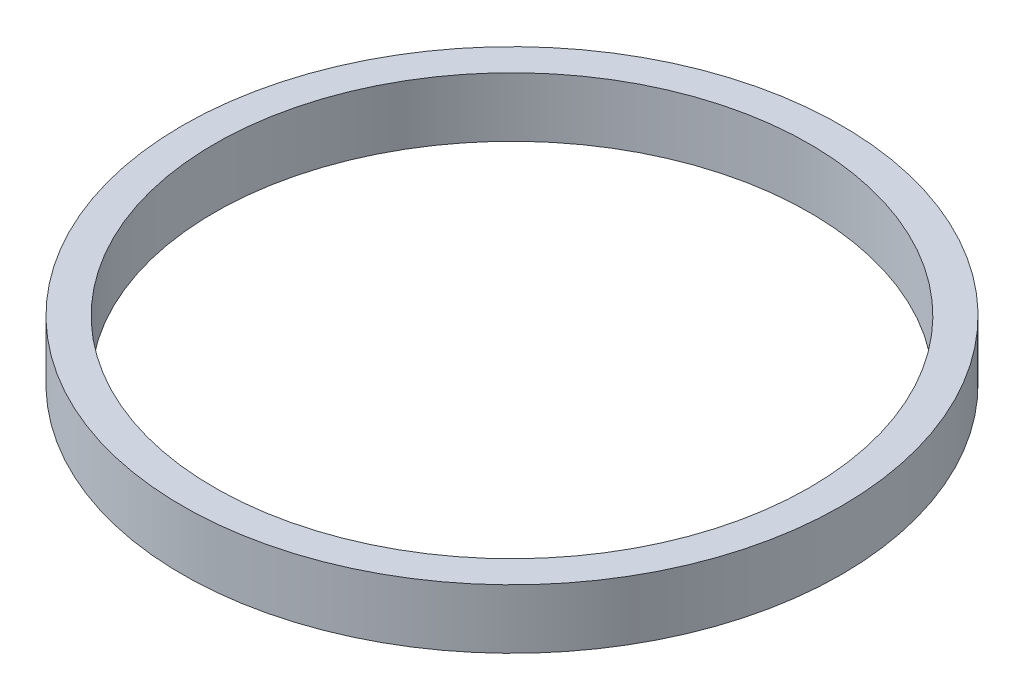
from build123d import *

# Parameters (mm, degrees)
SKETCH3_W = 7
SKETCH3_H = 13


with BuildPart() as part:
    # Sketch3 → Revolve1 (revolve)
    with BuildSketch(Plane.XY):
        with Locations((-68.7, 3.3)):
            Rectangle(SKETCH3_W, SKETCH3_H)
    revolve(axis=Axis((0, 0, 0), (0, 1, 0)))


solid = part.part
